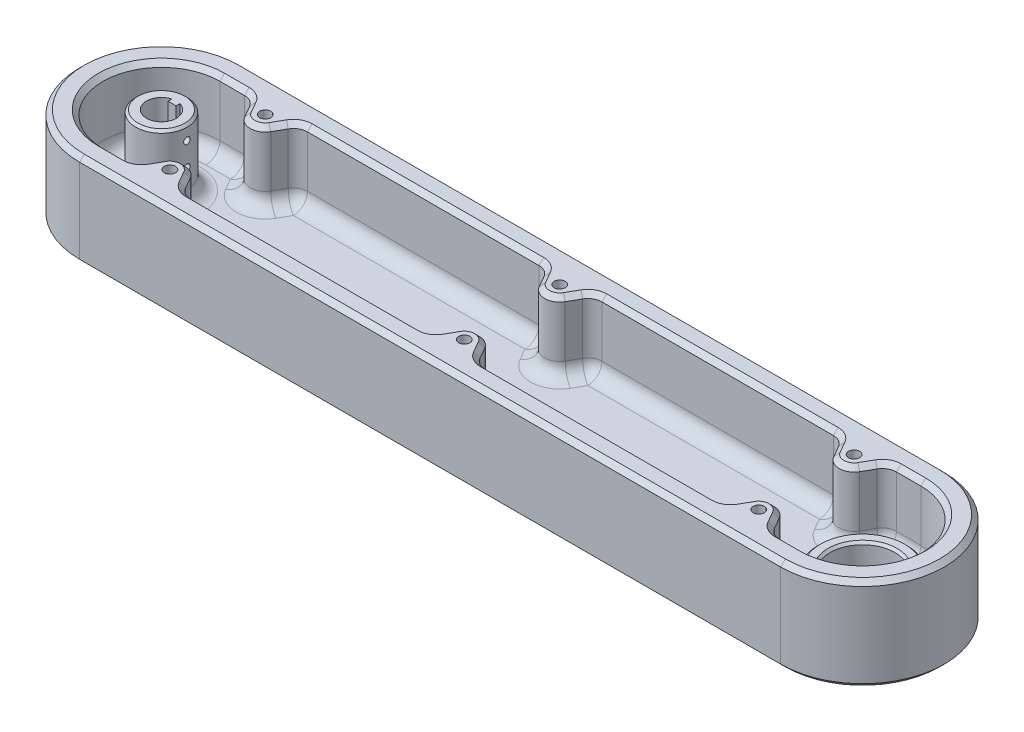
from build123d import *

# Parameters (mm, degrees)
MAINBLOCK_DEPTH              = 25.4
MAINPOCKET_DEPTH             = 19.05
SKETCH3_R                    = 6.985
SHAFTKEY_DEPTH               = 19.05
SHAFTHOLE_START              = -6.35
SKETCH4_R                    = 3.81
SHAFTHOLE_DEPTH              = 6.35
SKETCH5_R                    = 1.524
THREADEDINSERTSUPPORTS_DEPTH = 19.05
BEARINGSPACER_START          = 6.35
SKETCH8_R                    = 6.35
BEARINGSPACER_DEPTH          = 6.35
FILLET3_R                    = 2.54
SKETCH10_R                   = 12.065
SKETCH10_R_2                 = 8.763
BOSS_EXTRUDE1_DEPTH          = 6.35
SKETCH7_R                    = 0.889
CUT_EXTRUDE4_DEPTH           = 95.25
FILLET4_R                    = 3.81
CHAMFER1_SIZE                = 0.635
CHAMFER2_SIZE                = 1.27
CHAMFER3_SIZE                = 0.635


with BuildPart() as part:
    # Sketch1 → MainBlock (new body)
    with BuildSketch(Plane(origin=(0, 0, 0), x_dir=(1, 0, 0), z_dir=(0, 1, 0))):
        with BuildLine():
            Line((-95.25, 22.225), (95.25, 22.225))
            ThreePointArc((95.25, 22.225), (117.475, 0), (95.25, -22.225))
            Line((95.25, -22.225), (-95.25, -22.225))
            ThreePointArc((-95.25, -22.225), (-117.475, 0), (-95.25, 22.225))
        make_face()
    extrude(amount=MAINBLOCK_DEPTH)

    # Sketch2 → MainPocket (cut)
    with BuildSketch(Plane(origin=(0, 25.4, 0), x_dir=(1, 0, 0), z_dir=(0, 1, 0))):
        with BuildLine():
            Line((-95.25, 15.875), (95.25, 15.875))
            ThreePointArc((95.25, 15.875), (111.125, 0), (95.25, -15.875))
            Line((95.25, -15.875), (-95.25, -15.875))
            ThreePointArc((-95.25, -15.875), (-111.125, 0), (-95.25, 15.875))
        make_face()
    extrude(amount=-MAINPOCKET_DEPTH, mode=Mode.SUBTRACT)

    # Sketch3 → ShaftKey (add)
    with BuildSketch(Plane(origin=(0, 6.35, 0), x_dir=(1, 0, 0), z_dir=(0, 1, 0))):
        with Locations(Location((-95.25, 0, 0), (0, 0, 90))):
            Circle(SKETCH3_R)
        with BuildLine():
            Line((-96.3295, 3.918006604), (-96.3295, 2.873375))
            Line((-96.3295, 2.873375), (-94.1705, 2.873375))
            Line((-94.1705, 2.873375), (-94.1705, 3.918006604))
            ThreePointArc((-94.1705, 3.918006604), (-95.25, -4.064), (-96.3295, 3.918006604))
        make_face(mode=Mode.SUBTRACT)
    extrude(amount=SHAFTKEY_DEPTH)

    # Sketch4 → ShaftHole (cut)
    with BuildSketch(Plane(origin=(0, 6.35, 0), x_dir=(1, 0, 0), z_dir=(0, 1, 0)).offset(SHAFTHOLE_START)):
        with Locations(Location((95.25, 0, 0), (0, 0, 270))):
            Circle(SKETCH4_R)
        with BuildLine():
            Line((-94.1705, 2.873375), (-96.3295, 2.873375))
            Line((-96.3295, 2.873375), (-96.3295, 3.918006604))
            ThreePointArc((-96.3295, 3.918006604), (-95.25, -4.064), (-94.1705, 3.918006604))
            Line((-94.1705, 3.918006604), (-94.1705, 2.873375))
        make_face()
    extrude(amount=SHAFTHOLE_DEPTH, mode=Mode.SUBTRACT)

    # Sketch5 → ThreadedInsertSupports (add)
    # profile 1 of 6: a face of its own
    with BuildSketch(Plane(origin=(0, 6.35, 0), x_dir=(1, 0, 0), z_dir=(0, 1, 0))):
        with BuildLine():
            Line((-83.538496831, 10.937615584), (-86.36, 15.875))
            Line((-86.36, 15.875), (-73.66, 15.875))
            Line((-73.66, 15.875), (-76.481503169, 10.937615584))
            ThreePointArc((-76.481503169, 10.937615584), (-80.01, 8.89), (-83.538496831, 10.937615584))
        make_face()
        with Locations(Location((-80.01, 12.954, 0), (0, 0, 270))):
            Circle(SKETCH5_R, mode=Mode.SUBTRACT)
    # profile 2 of 6: a face of its own
    with BuildSketch(Plane(origin=(0, 6.35, 0), x_dir=(1, 0, 0), z_dir=(0, 1, 0))):
        with BuildLine():
            Line((-3.528496831, 10.937615584), (-6.35, 15.875))
            Line((-6.35, 15.875), (6.35, 15.875))
            Line((6.35, 15.875), (3.528496831, 10.937615584))
            ThreePointArc((3.528496831, 10.937615584), (0, 8.89), (-3.528496831, 10.937615584))
        make_face()
        with Locations(Location((0, 12.954, 0), (0, 0, 270))):
            Circle(SKETCH5_R, mode=Mode.SUBTRACT)
    # profile 3 of 6: a face of its own
    with BuildSketch(Plane(origin=(0, 6.35, 0), x_dir=(1, 0, 0), z_dir=(0, 1, 0))):
        with BuildLine():
            Line((-6.35, -15.875), (6.35, -15.875))
            Line((6.35, -15.875), (3.528496831, -10.937615584))
            ThreePointArc((3.528496831, -10.937615584), (0, -8.89), (-3.528496831, -10.937615584))
            Line((-3.528496831, -10.937615584), (-6.35, -15.875))
        make_face()
        with Locations(Location((0, -12.954, 0), (0, 0, 90))):
            Circle(SKETCH5_R, mode=Mode.SUBTRACT)
    # profile 4 of 6: a face of its own
    with BuildSketch(Plane(origin=(0, 6.35, 0), x_dir=(1, 0, 0), z_dir=(0, 1, 0))):
        with BuildLine():
            Line((-73.66, -15.875), (-86.36, -15.875))
            Line((-86.36, -15.875), (-83.538496831, -10.937615584))
            ThreePointArc((-83.538496831, -10.937615584), (-80.01, -8.89), (-76.481503169, -10.937615584))
            Line((-76.481503169, -10.937615584), (-73.66, -15.875))
        make_face()
        with Locations(Location((-80.01, -12.954, 0), (0, 0, 90))):
            Circle(SKETCH5_R, mode=Mode.SUBTRACT)
    # profile 5 of 6: a face of its own
    with BuildSketch(Plane(origin=(0, 6.35, 0), x_dir=(1, 0, 0), z_dir=(0, 1, 0))):
        with BuildLine():
            Line((83.538496831, -10.937615584), (86.36, -15.875))
            Line((86.36, -15.875), (73.66, -15.875))
            Line((73.66, -15.875), (76.481503169, -10.937615584))
            ThreePointArc((76.481503169, -10.937615584), (80.01, -8.89), (83.538496831, -10.937615584))
        make_face()
        with Locations(Location((80.01, -12.954, 0), (0, 0, 270))):
            Circle(SKETCH5_R, mode=Mode.SUBTRACT)
    # profile 6 of 6: a face of its own
    with BuildSketch(Plane(origin=(0, 6.35, 0), x_dir=(1, 0, 0), z_dir=(0, 1, 0))):
        with BuildLine():
            Line((73.66, 15.875), (86.36, 15.875))
            Line((86.36, 15.875), (83.538496831, 10.937615584))
            ThreePointArc((83.538496831, 10.937615584), (80.01, 8.89), (76.481503169, 10.937615584))
            Line((76.481503169, 10.937615584), (73.66, 15.875))
        make_face()
        with Locations(Location((80.01, 12.954, 0), (0, 0, 90))):
            Circle(SKETCH5_R, mode=Mode.SUBTRACT)
    extrude(amount=THREADEDINSERTSUPPORTS_DEPTH)

    # Sketch8 → BearingSpacer (add)
    with BuildSketch(Plane.XZ.offset(BEARINGSPACER_START)):
        with Locations(Location((-95.25, 0, 0), (0, 0, 90))):
            Circle(SKETCH8_R)
        with BuildLine():
            Line((-96.3295, -3.918006604), (-96.3295, -2.873375))
            Line((-96.3295, -2.873375), (-94.1705, -2.873375))
            Line((-94.1705, -2.873375), (-94.1705, -3.918006604))
            ThreePointArc((-94.1705, -3.918006604), (-95.25, 4.064), (-96.3295, -3.918006604))
        make_face(mode=Mode.SUBTRACT)
    extrude(amount=-BEARINGSPACER_DEPTH)

    # Fillet3
    fillet3_edges = [part.edges().sort_by_distance(p)[0] for p in [
        (-95.25, 0, -6.35),
    ]]
    fillet(fillet3_edges, radius=FILLET3_R)

    # Sketch10 → Boss-Extrude1 (add)
    with BuildSketch(Plane(origin=(0, 6.35, 0), x_dir=(1, 0, 0), z_dir=(0, 1, 0))):
        with Locations(Location((95.25, 0, 0), (0, 0, 90))):
            Circle(SKETCH10_R)
        with Locations(Location((95.25, 0, 0), (0, 0, 270))):
            Circle(SKETCH10_R_2, mode=Mode.SUBTRACT)
    extrude(amount=BOSS_EXTRUDE1_DEPTH)

    # Sketch7 → Cut-Extrude4 (cut, symmetric)
    with BuildSketch(Plane(origin=(0, 0, 0), x_dir=(0, 0, -1), z_dir=(1, 0, 0))):
        with Locations((0, 21.59)):
            Circle(SKETCH7_R)
        with Locations((0, 15.24)):
            Circle(SKETCH7_R)
    extrude(amount=CUT_EXTRUDE4_DEPTH, both=True, mode=Mode.SUBTRACT)

    # Fillet4
    # the kernel refuses this fillet: 3.81 mm, written as the material it adds along each edge
    with BuildSketch(Plane(origin=(88.570974177, 10.16, -12.065), x_dir=(0, 0, -1), z_dir=(0, -1, 0))) as fillet4_piece_1_section:
        Polygon((0, 0), (FILLET4_R, 0), (FILLET4_R, -FILLET4_R * 0.580308182836), (FILLET4_R * 0.496157582609, -FILLET4_R * 0.868232488), align=None)
    fillet4_piece_1 = extrude(amount=FILLET4_R, mode=Mode.PRIVATE)
    fillet4_piece_1 = fillet4_piece_1 - Plane(origin=(88.570974177, 10.16, -12.065), x_dir=(0.5019175317672279, 0, 0.8649154821742375), z_dir=(0, -1, 0)) * Sphere(FILLET4_R, mode=Mode.PRIVATE)
    add(fillet4_piece_1)
    with BuildSketch(Plane(origin=(88.570974177, 10.16, 12.065), x_dir=(-0.8682324880003102, 0, 0.49615758260938775), z_dir=(0, -1, 0))) as fillet4_piece_2_section:
        Polygon((0, 0), (FILLET4_R, 0), (FILLET4_R, -FILLET4_R * 0.580308182836), (FILLET4_R * 0.496157582609, -FILLET4_R * 0.868232488), align=None)
    fillet4_piece_2 = extrude(amount=FILLET4_R, mode=Mode.PRIVATE)
    fillet4_piece_2 = fillet4_piece_2 - Plane(origin=(88.570974177, 10.16, 12.065), x_dir=(0.5019175317672279, 0, -0.8649154821742375), z_dir=(0, -1, 0)) * Sphere(FILLET4_R, mode=Mode.PRIVATE)
    add(fillet4_piece_2)
    with BuildSketch(Plane(origin=(71.449025823, 10.16, 12.065), x_dir=(0, 0, 1), z_dir=(0, -1, 0))) as fillet4_piece_3_section:
        Polygon((0, 0), (FILLET4_R, 0), (FILLET4_R, -FILLET4_R * 0.580308182836), (FILLET4_R * 0.496157582609, -FILLET4_R * 0.868232488), align=None)
    fillet4_piece_3 = extrude(amount=FILLET4_R, mode=Mode.PRIVATE)
    fillet4_piece_3 = fillet4_piece_3 - Plane(origin=(71.449025823, 10.16, 12.065), x_dir=(-0.5019175317672289, 0, -0.8649154821742371), z_dir=(0, -1, 0)) * Sphere(FILLET4_R, mode=Mode.PRIVATE)
    add(fillet4_piece_3)
    with BuildSketch(Plane(origin=(8.560974177, 10.16, 12.065), x_dir=(-0.8682324880003144, 0, 0.4961575826093803), z_dir=(0, -1, 0))) as fillet4_piece_4_section:
        Polygon((0, 0), (FILLET4_R, 0), (FILLET4_R, -FILLET4_R * 0.580308182836), (FILLET4_R * 0.496157582609, -FILLET4_R * 0.868232488), align=None)
    fillet4_piece_4 = extrude(amount=FILLET4_R, mode=Mode.PRIVATE)
    fillet4_piece_4 = fillet4_piece_4 - Plane(origin=(8.560974177, 10.16, 12.065), x_dir=(0.5019175317672315, 0, -0.8649154821742354), z_dir=(0, -1, 0)) * Sphere(FILLET4_R, mode=Mode.PRIVATE)
    add(fillet4_piece_4)
    with BuildSketch(Plane(origin=(-8.560974177, 10.16, 12.065), x_dir=(0, 0, 1), z_dir=(0, -1, 0))) as fillet4_piece_5_section:
        Polygon((0, 0), (FILLET4_R, 0), (FILLET4_R, -FILLET4_R * 0.580308182836), (FILLET4_R * 0.496157582609, -FILLET4_R * 0.868232488), align=None)
    fillet4_piece_5 = extrude(amount=FILLET4_R, mode=Mode.PRIVATE)
    fillet4_piece_5 = fillet4_piece_5 - Plane(origin=(-8.560974177, 10.16, 12.065), x_dir=(-0.5019175317672315, 0, -0.8649154821742354), z_dir=(0, -1, 0)) * Sphere(FILLET4_R, mode=Mode.PRIVATE)
    add(fillet4_piece_5)
    with BuildSketch(Plane(origin=(-71.449025823, 10.16, 12.065), x_dir=(-0.8682324880003113, 0, 0.49615758260938586), z_dir=(0, -1, 0))) as fillet4_piece_6_section:
        Polygon((0, 0), (FILLET4_R, 0), (FILLET4_R, -FILLET4_R * 0.580308182836), (FILLET4_R * 0.496157582609, -FILLET4_R * 0.868232488), align=None)
    fillet4_piece_6 = extrude(amount=FILLET4_R, mode=Mode.PRIVATE)
    fillet4_piece_6 = fillet4_piece_6 - Plane(origin=(-71.449025823, 10.16, 12.065), x_dir=(0.5019175317672289, 0, -0.8649154821742371), z_dir=(0, -1, 0)) * Sphere(FILLET4_R, mode=Mode.PRIVATE)
    add(fillet4_piece_6)
    with BuildSketch(Plane(origin=(-88.570974177, 10.16, 12.065), x_dir=(0, 0, 1), z_dir=(0, -1, 0))) as fillet4_piece_7_section:
        Polygon((0, 0), (FILLET4_R, 0), (FILLET4_R, -FILLET4_R * 0.580308182836), (FILLET4_R * 0.496157582609, -FILLET4_R * 0.868232488), align=None)
    fillet4_piece_7 = extrude(amount=FILLET4_R, mode=Mode.PRIVATE)
    fillet4_piece_7 = fillet4_piece_7 - Plane(origin=(-88.570974177, 10.16, 12.065), x_dir=(-0.5019175317672279, 0, -0.8649154821742375), z_dir=(0, -1, 0)) * Sphere(FILLET4_R, mode=Mode.PRIVATE)
    add(fillet4_piece_7)
    with BuildSketch(Plane(origin=(-88.570974177, 10.16, -12.065), x_dir=(0, 0, -1), z_dir=(0, -1, 0))) as fillet4_piece_8_section:
        Polygon((0, 0), (FILLET4_R, 0), (FILLET4_R, FILLET4_R * 0.580308182836), (FILLET4_R * 0.496157582609, FILLET4_R * 0.868232488), align=None)
    fillet4_piece_8 = extrude(amount=FILLET4_R, mode=Mode.PRIVATE)
    fillet4_piece_8 = fillet4_piece_8 - Plane(origin=(-88.570974177, 10.16, -12.065), x_dir=(-0.5019175317672279, 0, 0.8649154821742375), z_dir=(0, -1, 0)) * Sphere(FILLET4_R, mode=Mode.PRIVATE)
    add(fillet4_piece_8)
    with BuildSketch(Plane(origin=(-71.449025823, 10.16, -12.065), x_dir=(0, 0, -1), z_dir=(0, -1, 0))) as fillet4_piece_9_section:
        Polygon((0, 0), (FILLET4_R, 0), (FILLET4_R, -FILLET4_R * 0.580308182836), (FILLET4_R * 0.496157582609, -FILLET4_R * 0.868232488), align=None)
    fillet4_piece_9 = extrude(amount=FILLET4_R, mode=Mode.PRIVATE)
    fillet4_piece_9 = fillet4_piece_9 - Plane(origin=(-71.449025823, 10.16, -12.065), x_dir=(0.5019175317672289, 0, 0.8649154821742371), z_dir=(0, -1, 0)) * Sphere(FILLET4_R, mode=Mode.PRIVATE)
    add(fillet4_piece_9)
    with BuildSketch(Plane(origin=(-8.560974177, 10.16, -12.065), x_dir=(0, 0, -1), z_dir=(0, -1, 0))) as fillet4_piece_10_section:
        Polygon((0, 0), (FILLET4_R, 0), (FILLET4_R, FILLET4_R * 0.580308182836), (FILLET4_R * 0.496157582609, FILLET4_R * 0.868232488), align=None)
    fillet4_piece_10 = extrude(amount=FILLET4_R, mode=Mode.PRIVATE)
    fillet4_piece_10 = fillet4_piece_10 - Plane(origin=(-8.560974177, 10.16, -12.065), x_dir=(-0.5019175317672315, 0, 0.8649154821742354), z_dir=(0, -1, 0)) * Sphere(FILLET4_R, mode=Mode.PRIVATE)
    add(fillet4_piece_10)
    with BuildSketch(Plane(origin=(8.560974177, 10.16, -12.065), x_dir=(0, 0, -1), z_dir=(0, -1, 0))) as fillet4_piece_11_section:
        Polygon((0, 0), (FILLET4_R, 0), (FILLET4_R, -FILLET4_R * 0.580308182836), (FILLET4_R * 0.496157582609, -FILLET4_R * 0.868232488), align=None)
    fillet4_piece_11 = extrude(amount=FILLET4_R, mode=Mode.PRIVATE)
    fillet4_piece_11 = fillet4_piece_11 - Plane(origin=(8.560974177, 10.16, -12.065), x_dir=(0.5019175317672315, 0, 0.8649154821742354), z_dir=(0, -1, 0)) * Sphere(FILLET4_R, mode=Mode.PRIVATE)
    add(fillet4_piece_11)
    with BuildSketch(Plane(origin=(71.449025823, 10.16, -12.065), x_dir=(0.8682324880003113, 0, -0.49615758260938586), z_dir=(0, -1, 0))) as fillet4_piece_12_section:
        Polygon((0, 0), (FILLET4_R, 0), (FILLET4_R, -FILLET4_R * 0.580308182836), (FILLET4_R * 0.496157582609, -FILLET4_R * 0.868232488), align=None)
    fillet4_piece_12 = extrude(amount=FILLET4_R, mode=Mode.PRIVATE)
    fillet4_piece_12 = fillet4_piece_12 - Plane(origin=(71.449025823, 10.16, -12.065), x_dir=(-0.5019175317672289, 0, 0.8649154821742371), z_dir=(0, -1, 0)) * Sphere(FILLET4_R, mode=Mode.PRIVATE)
    add(fillet4_piece_12)
    with BuildSketch(Plane(origin=(-95.25, 6.35, 0), x_dir=(0, 0, -1), z_dir=(1, 0, 0))) as fillet4_piece_13:
        with BuildLine():
            CenterArc((6.985 + FILLET4_R, FILLET4_R), FILLET4_R, 180, 90)
            Line((6.985, FILLET4_R), (6.985, 0))
            Line((6.985, 0), (6.985 + FILLET4_R, 0))
        make_face()
    revolve(axis=Axis((-95.25, 6.35, 0), (0, 1, 0)))
    with BuildSketch(Plane(origin=(80.01, 6.35, -12.954), x_dir=(0.868232488000307, 0, 0.49615758260939335), z_dir=(0.49615758260939335, 0, -0.868232488000307))) as fillet4_piece_14:
        with BuildLine():
            CenterArc((4.064 + FILLET4_R, -FILLET4_R), FILLET4_R, 90, 90)
            Line((4.064 + FILLET4_R, 0), (4.064, 0))
            Line((4.064, 0), (4.064, -FILLET4_R))
        make_face()
    revolve(axis=Axis((80.01, 6.35, -12.954), (0, -1, 0)), revolution_arc=120.507776705)
    with BuildSketch(Plane(origin=(85.263008397, 6.35, -13.95536039), x_dir=(0, 1, 0), z_dir=(-0.49615758260938775, 0, 0.8682324880003102)), Plane(origin=(83.538496831, 6.35, 10.937615584), x_dir=(0, 1, 0), z_dir=(0.49615758260938775, 0, 0.8682324880003102)), Plane(origin=(74.756991603, 6.35, 13.95536039), x_dir=(0, 1, 0), z_dir=(0.49615758260938586, 0, -0.8682324880003113)), Plane(origin=(-76.481503169, 6.35, 10.937615584), x_dir=(0, 1, 0), z_dir=(0.49615758260938586, 0, 0.8682324880003113)), Plane(origin=(-85.263008397, 6.35, 13.95536039), x_dir=(0, 1, 0), z_dir=(0.49615758260938775, 0, -0.8682324880003102)), Plane(origin=(-83.538496831, 6.35, -10.937615584), x_dir=(0, 1, 0), z_dir=(-0.49615758260938775, 0, -0.8682324880003102)), Plane(origin=(-74.756991603, 6.35, -13.95536039), x_dir=(0, 1, 0), z_dir=(-0.49615758260938586, 0, 0.8682324880003113)), Plane(origin=(-3.528496831, 6.35, -10.937615584), x_dir=(0, 1, 0), z_dir=(-0.4961575826093803, 0, -0.8682324880003144)), Plane(origin=(5.253008397, 6.35, -13.95536039), x_dir=(0, 1, 0), z_dir=(-0.4961575826093803, 0, 0.8682324880003144)), Plane(origin=(76.481503169, 6.35, -10.937615584), x_dir=(0, 1, 0), z_dir=(-0.49615758260938586, 0, -0.8682324880003113))) as fillet4_piece_15:
        with BuildLine():
            CenterArc((FILLET4_R, -FILLET4_R), FILLET4_R, 90, 90)
            Line((0, -FILLET4_R), (0, 0))
            Line((0, 0), (FILLET4_R, 0))
        make_face()
    extrude(amount=3.47573357)
    with BuildSketch(Plane(origin=(88.570974177, 6.35, -15.875), x_dir=(0, 1, 0), z_dir=(1, 0, 0)), Plane(origin=(95.25, 6.35, 15.875), x_dir=(0, 1, 0), z_dir=(-1, 0, 0)), Plane(origin=(-88.570974177, 6.35, 15.875), x_dir=(0, 1, 0), z_dir=(-1, 0, 0)), Plane(origin=(-95.25, 6.35, -15.875), x_dir=(0, 1, 0), z_dir=(1, 0, 0))) as fillet4_piece_16:
        with BuildLine():
            CenterArc((FILLET4_R, FILLET4_R), FILLET4_R, 180, 90)
            Line((0, FILLET4_R), (0, 0))
            Line((0, 0), (FILLET4_R, 0))
        make_face()
    extrude(amount=6.679025823)
    with BuildSketch(Plane(origin=(95.25, 6.35, 0), x_dir=(0, 0, -1), z_dir=(-1, 0, 0))) as fillet4_piece_17:
        with BuildLine():
            CenterArc((15.875 - FILLET4_R, -FILLET4_R), FILLET4_R, 0, 90)
            Line((15.875 - FILLET4_R, 0), (15.875, 0))
            Line((15.875, 0), (15.875, -FILLET4_R))
        make_face()
    revolve(axis=Axis((95.25, 6.35, 0), (0, -1, 0)), revolution_arc=180)
    with BuildSketch(Plane(origin=(80.01, 6.35, 12.954), x_dir=(-0.868232488000307, 0, -0.49615758260939335), z_dir=(-0.49615758260939335, 0, 0.868232488000307))) as fillet4_piece_18:
        with BuildLine():
            CenterArc((4.064 + FILLET4_R, -FILLET4_R), FILLET4_R, 90, 90)
            Line((4.064 + FILLET4_R, 0), (4.064, 0))
            Line((4.064, 0), (4.064, -FILLET4_R))
        make_face()
    revolve(axis=Axis((80.01, 6.35, 12.954), (0, -1, 0)), revolution_arc=120.507776705)
    with BuildSketch(Plane(origin=(71.449025823, 6.35, 15.875), x_dir=(0, 1, 0), z_dir=(-1, 0, 0)), Plane(origin=(-8.560974177, 6.35, 15.875), x_dir=(0, 1, 0), z_dir=(-1, 0, 0)), Plane(origin=(-71.449025823, 6.35, -15.875), x_dir=(0, 1, 0), z_dir=(1, 0, 0)), Plane(origin=(8.560974177, 6.35, -15.875), x_dir=(0, 1, 0), z_dir=(1, 0, 0))) as fillet4_piece_19:
        with BuildLine():
            CenterArc((FILLET4_R, FILLET4_R), FILLET4_R, 180, 90)
            Line((0, FILLET4_R), (0, 0))
            Line((0, 0), (FILLET4_R, 0))
        make_face()
    extrude(amount=62.888051647)
    with BuildSketch(Plane(origin=(5.253008397, 6.35, 13.95536039), x_dir=(0, 1, 0), z_dir=(-0.4961575826093803, 0, -0.8682324880003144)), Plane(origin=(-3.528496831, 6.35, 10.937615584), x_dir=(0, 1, 0), z_dir=(-0.4961575826093803, 0, 0.8682324880003144))) as fillet4_piece_20:
        with BuildLine():
            CenterArc((FILLET4_R, FILLET4_R), FILLET4_R, 180, 90)
            Line((0, FILLET4_R), (0, 0))
            Line((0, 0), (FILLET4_R, 0))
        make_face()
    extrude(amount=3.47573357)
    with BuildSketch(Plane(origin=(0, 6.35, 12.954), x_dir=(0.8682324880003145, 0, -0.49615758260938003), z_dir=(0.49615758260938003, 0, 0.8682324880003145))) as fillet4_piece_21:
        with BuildLine():
            CenterArc((4.064 + FILLET4_R, FILLET4_R), FILLET4_R, 180, 90)
            Line((4.064 + FILLET4_R, 0), (4.064, 0))
            Line((4.064, 0), (4.064, FILLET4_R))
        make_face()
    revolve(axis=Axis((0, 6.35, 12.954), (0, 1, 0)), revolution_arc=120.507776705)
    with BuildSketch(Plane(origin=(-80.01, 6.35, 12.954), x_dir=(-0.868232488000307, 0, -0.49615758260939335), z_dir=(-0.49615758260939335, 0, 0.868232488000307))) as fillet4_piece_22:
        with BuildLine():
            CenterArc((4.064 + FILLET4_R, -FILLET4_R), FILLET4_R, 90, 90)
            Line((4.064 + FILLET4_R, 0), (4.064, 0))
            Line((4.064, 0), (4.064, -FILLET4_R))
        make_face()
    revolve(axis=Axis((-80.01, 6.35, 12.954), (0, -1, 0)), revolution_arc=120.507776705)
    with BuildSketch(Plane(origin=(-95.25, 6.35, 0), x_dir=(0, 0, 1), z_dir=(1, 0, 0))) as fillet4_piece_23:
        with BuildLine():
            CenterArc((15.875 - FILLET4_R, -FILLET4_R), FILLET4_R, 0, 90)
            Line((15.875 - FILLET4_R, 0), (15.875, 0))
            Line((15.875, 0), (15.875, -FILLET4_R))
        make_face()
    revolve(axis=Axis((-95.25, 6.35, 0), (0, -1, 0)), revolution_arc=180)
    with BuildSketch(Plane(origin=(-80.01, 6.35, -12.954), x_dir=(0.868232488000307, 0, 0.49615758260939335), z_dir=(0.49615758260939335, 0, -0.868232488000307))) as fillet4_piece_24:
        with BuildLine():
            CenterArc((4.064 + FILLET4_R, -FILLET4_R), FILLET4_R, 90, 90)
            Line((4.064 + FILLET4_R, 0), (4.064, 0))
            Line((4.064, 0), (4.064, -FILLET4_R))
        make_face()
    revolve(axis=Axis((-80.01, 6.35, -12.954), (0, -1, 0)), revolution_arc=120.507776705)
    with BuildSketch(Plane(origin=(0, 6.35, -12.954), x_dir=(0.8682324880003145, 0, 0.49615758260938003), z_dir=(0.49615758260938003, 0, -0.8682324880003145))) as fillet4_piece_25:
        with BuildLine():
            CenterArc((4.064 + FILLET4_R, -FILLET4_R), FILLET4_R, 90, 90)
            Line((4.064 + FILLET4_R, 0), (4.064, 0))
            Line((4.064, 0), (4.064, -FILLET4_R))
        make_face()
    revolve(axis=Axis((0, 6.35, -12.954), (0, -1, 0)), revolution_arc=120.507776705)
    with BuildSketch(Plane(origin=(95.25, 6.35, 0), x_dir=(0, 0, -1), z_dir=(1, 0, 0))) as fillet4_piece_26:
        with BuildLine():
            CenterArc((12.065 + FILLET4_R, FILLET4_R), FILLET4_R, 180, 90)
            Line((12.065, FILLET4_R), (12.065, 0))
            Line((12.065, 0), (12.065 + FILLET4_R, 0))
        make_face()
    revolve(axis=Axis((95.25, 6.35, 0), (0, 1, 0)))
    with BuildSketch(Plane(origin=(86.36, 10.16, 15.875), x_dir=(-0.4961575826093885, 0, -0.8682324880003095), z_dir=(0, 1, 0)), Plane(origin=(73.66, 10.16, 15.875), x_dir=(-1, 0, 0), z_dir=(0, 1, 0)), Plane(origin=(6.35, 10.16, 15.875), x_dir=(-0.4961575826093802, 0, -0.8682324880003143), z_dir=(0, 1, 0)), Plane(origin=(-6.35, 10.16, 15.875), x_dir=(-1, 0, 0), z_dir=(0, 1, 0)), Plane(origin=(-73.66, 10.16, 15.875), x_dir=(-0.49615758260938514, 0, -0.8682324880003116), z_dir=(0, 1, 0)), Plane(origin=(-86.36, 10.16, 15.875), x_dir=(-1, 0, 0), z_dir=(0, 1, 0)), Plane(origin=(86.36, 10.16, -15.875), x_dir=(1, 0, 0), z_dir=(0, 1, 0)), Plane(origin=(73.66, 10.16, -15.875), x_dir=(0.49615758260938514, 0, 0.8682324880003116), z_dir=(0, 1, 0)), Plane(origin=(6.35, 10.16, -15.875), x_dir=(1, 0, 0), z_dir=(0, 1, 0)), Plane(origin=(-6.35, 10.16, -15.875), x_dir=(0.4961575826093802, 0, 0.8682324880003143), z_dir=(0, 1, 0)), Plane(origin=(-73.66, 10.16, -15.875), x_dir=(1, 0, 0), z_dir=(0, 1, 0))) as fillet4_piece_27:
        with BuildLine():
            CenterArc((FILLET4_R * 0.580308182836, -FILLET4_R), FILLET4_R, 90, 60.253888352)
            Line((-FILLET4_R * 0.287924305164, -FILLET4_R * 0.503842417391), (0, 0))
            Line((0, 0), (FILLET4_R * 0.580308182836, 0))
        make_face()
    extrude(amount=15.24)
    with BuildSketch(Plane(origin=(-86.36, 10.16, -15.875), x_dir=(-1, 0, 0), z_dir=(0, 1, 0))) as fillet4_piece_28:
        with BuildLine():
            CenterArc((FILLET4_R * 0.580308182836, FILLET4_R), FILLET4_R, 209.746111648, 60.253888352)
            Line((-FILLET4_R * 0.287924305164, FILLET4_R * 0.503842417391), (0, 0))
            Line((0, 0), (FILLET4_R * 0.580308182836, 0))
        make_face()
    extrude(amount=15.24)

    # Chamfer1
    chamfer1_edges = [part.edges().sort_by_distance(p)[0] for p in [
        (95.25, 12.7, 12.065),
        (95.25, 12.7, -8.763),
        (-95.25, 25.4, 6.985),
    ]]
    chamfer(chamfer1_edges, length=CHAMFER1_SIZE)

    # Chamfer2
    chamfer2_edges = [part.edges().sort_by_distance(p)[0] for p in [
        (0, 25.4, 8.89),
        (-4.390752614, 25.4, 12.446487987),
        (-80.01, 25.4, 8.89),
        (-84.400752614, 25.4, 12.446487987),
        (117.475, 25.4, 0),
        (80.01, 25.4, 8.89),
        (75.619247386, 25.4, 12.446487987),
        (80.01, 25.4, -8.89),
        (84.400752614, 25.4, -12.446487987),
        (0, 25.4, -22.225),
        (111.125, 25.4, 0),
        (91.910487088, 25.4, -15.875),
        (-111.125, 25.4, 0),
        (-91.910487088, 25.4, 15.875),
        (91.910487088, 25.4, 15.875),
        (84.400752614, 25.4, 12.446487987),
        (40.005, 25.4, 15.875),
        (4.390752614, 25.4, 12.446487987),
        (-40.005, 25.4, 15.875),
        (-75.619247386, 25.4, 12.446487987),
        (-91.910487088, 25.4, -15.875),
        (-84.400752614, 25.4, -12.446487987),
        (-40.005, 25.4, -15.875),
        (-4.390752614, 25.4, -12.446487987),
        (40.005, 25.4, -15.875),
        (75.619247386, 25.4, -12.446487987),
        (86.658668381, 25.4, 15.360327987),
        (73.361331619, 25.4, 15.360327987),
        (6.648668381, 25.4, 15.360327987),
        (-6.648668381, 25.4, 15.360327987),
        (-73.361331619, 25.4, 15.360327987),
        (-86.658668381, 25.4, 15.360327987),
        (86.658668381, 25.4, -15.360327987),
        (73.361331619, 25.4, -15.360327987),
        (6.648668381, 25.4, -15.360327987),
        (-6.648668381, 25.4, -15.360327987),
        (-73.361331619, 25.4, -15.360327987),
        (-86.658668381, 25.4, -15.360327987),
        (-117.475, 25.4, 0),
        (0, 0, -22.225),
        (117.475, 0, 0),
        (0, 0, 22.225),
        (-117.475, 0, 0),
        (0, 25.4, -8.89),
        (4.390752614, 25.4, -12.446487987),
        (-80.01, 25.4, -8.89),
        (-75.619247386, 25.4, -12.446487987),
        (0, 25.4, 22.225),
    ]]
    chamfer(chamfer2_edges, length=CHAMFER2_SIZE)

    # Chamfer3
    chamfer3_edges = [part.edges().sort_by_distance(p)[0] for p in [
        (-95.25, -6.35, -6.35),
    ]]
    chamfer(chamfer3_edges, length=CHAMFER3_SIZE)


solid = part.part
